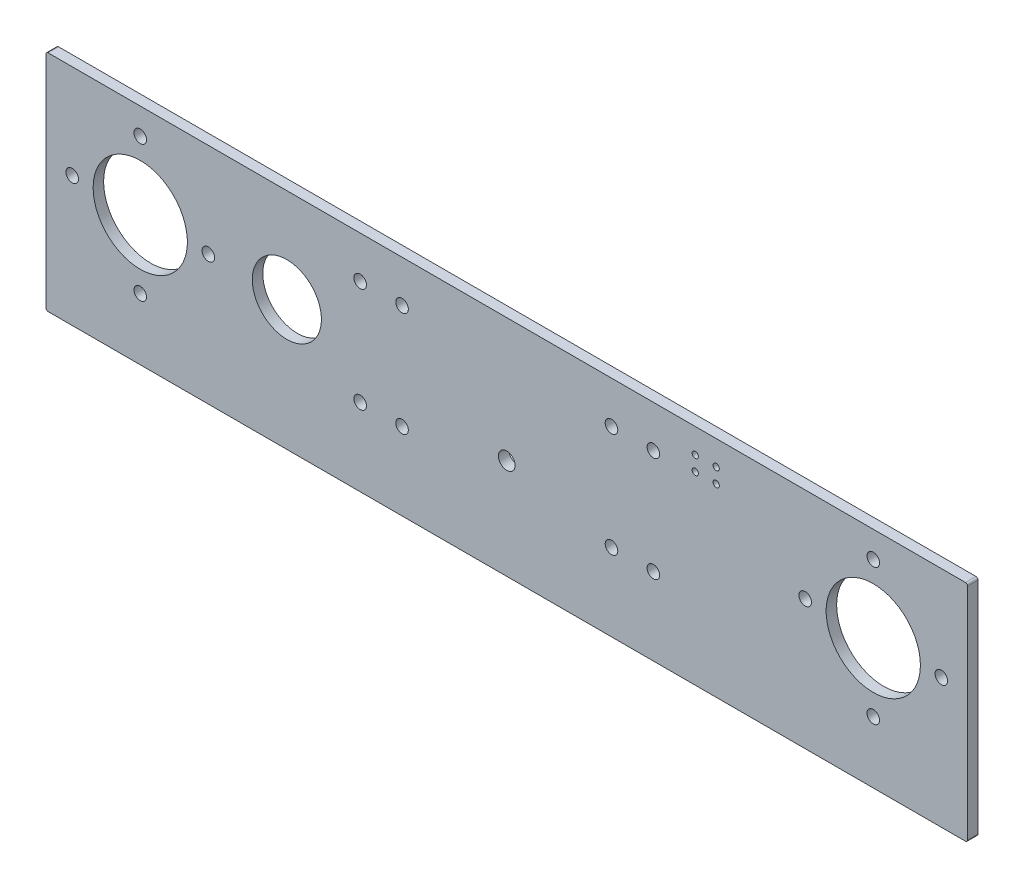
from build123d import *

# Parameters (mm, degrees)
SKETCH_1_W               = 440
SKETCH_1_H               = 107
SM_BASE_FLANGE_1_DEPTH   = 5
SKETCH_8_R               = 22.5
CUT_EXTRUDE_1_DEPTH      = 10
SKETCH_9_R               = 3
CUT_EXTRUDE_2_DEPTH      = 10
SKETCH_10_R              = 16.5
CUT_EXTRUDE_3_DEPTH      = 10
SKETCH_11_R              = 4
CUT_EXTRUDE_4_DEPTH      = 10
SKETCH_12_R              = 3
CUT_EXTRUDE_5_DEPTH      = 10
MIRROR_3_COPY_1_SKETCH_R = 3
MIRROR_3_COPY_1_DEPTH    = 10
FILLET_1_R               = 1
SKETCH_13_R              = 1.5
CUT_EXTRUDE_6_DEPTH      = 10


# Sheet-metal steps are written as plain solids
with BuildPart() as part:
    # Sketch 1 → 基体-法兰1 (new body)
    with BuildSketch(Plane.XY):
        Rectangle(SKETCH_1_W, SKETCH_1_H)
    extrude(amount=-SM_BASE_FLANGE_1_DEPTH)

    # 草图8 → 切除-拉伸1 (cut)
    with BuildSketch(Plane.XY):
        with Locations((175, 8.5)):
            Circle(SKETCH_8_R)
    cut_extrude_1 = extrude(amount=-CUT_EXTRUDE_1_DEPTH, mode=Mode.SUBTRACT)

    # 草图9 → 切除-拉伸2 (cut)
    with BuildSketch(Plane.XY):
        with Locations((175, 41)):
            Circle(SKETCH_9_R)
        with Locations((207.5, 8.5)):
            Circle(SKETCH_9_R)
        with Locations((175, -24)):
            Circle(SKETCH_9_R)
        with Locations((142.5, 8.5)):
            Circle(SKETCH_9_R)
    cut_extrude_2 = extrude(amount=-CUT_EXTRUDE_2_DEPTH, mode=Mode.SUBTRACT)

    # 镜向1: 切除-拉伸1, 切除-拉伸2 across plane
    add(cut_extrude_1.mirror(Plane(origin=(0, 0, 0), x_dir=(0, 0, 1), z_dir=(1, 0, 0))), mode=Mode.SUBTRACT)
    add(cut_extrude_2.mirror(Plane(origin=(0, 0, 0), x_dir=(0, 0, 1), z_dir=(1, 0, 0))), mode=Mode.SUBTRACT)

    # 草图10 → 切除-拉伸3 (cut)
    with BuildSketch(Plane(origin=(0, 0, -5), x_dir=(-1, 0, 0), z_dir=(0, 0, -1))):
        with Locations((105, 8.5)):
            Circle(SKETCH_10_R)
    extrude(amount=-CUT_EXTRUDE_3_DEPTH, mode=Mode.SUBTRACT)

    # 草图11 → 切除-拉伸4 (cut)
    with BuildSketch(Plane(origin=(0, 0, -5), x_dir=(-1, 0, 0), z_dir=(0, 0, -1))):
        with Locations((0, -5.630506542)):
            Circle(SKETCH_11_R)
    extrude(amount=-CUT_EXTRUDE_4_DEPTH, mode=Mode.SUBTRACT)

    # 草图12 → 切除-拉伸5 (cut)
    with BuildSketch(Plane(origin=(0, 0, -5), x_dir=(-1, 0, 0), z_dir=(0, 0, -1))):
        with Locations((-70, 33.5)):
            Circle(SKETCH_12_R)
        with Locations((-50, 33.5)):
            Circle(SKETCH_12_R)
    cut_extrude_5 = extrude(amount=-CUT_EXTRUDE_5_DEPTH, mode=Mode.SUBTRACT)

    # 镜向2: 切除-拉伸5 across plane
    add(cut_extrude_5.mirror(Plane(origin=(0, 0, 0), x_dir=(0, 0, 1), z_dir=(1, 0, 0))), mode=Mode.SUBTRACT)

    # 镜向3: 切除-拉伸5 across plane
    add(cut_extrude_5.mirror(Plane.ZX.offset(8.5)), mode=Mode.SUBTRACT)

    # 镜向3 copy 1 sketch → 镜向3 copy 1 (cut)
    with BuildSketch(Plane(origin=(0, 17, -5), x_dir=(1, 0, 0), z_dir=(0, 0, -1))):
        with Locations((-70, 33.5)):
            Circle(MIRROR_3_COPY_1_SKETCH_R)
        with Locations((-50, 33.5)):
            Circle(MIRROR_3_COPY_1_SKETCH_R)
    extrude(amount=-MIRROR_3_COPY_1_DEPTH, mode=Mode.SUBTRACT)

    # 圆角1
    fillet_1_edges = [part.edges().sort_by_distance(p)[0] for p in [
        (220, -53.5, -2.5),
        (-220, -53.5, -2.5),
        (-220, 53.5, -2.5),
        (220, 53.5, -2.5),
    ]]
    fillet(fillet_1_edges, radius=FILLET_1_R)

    # 草图13 → 切除-拉伸6 (cut)
    with BuildSketch(Plane(origin=(0, 0, -5), x_dir=(-1, 0, 0), z_dir=(0, 0, -1))):
        with Locations((-100, 41.75)):
            Circle(SKETCH_13_R)
        with Locations((-90, 41.75)):
            Circle(SKETCH_13_R)
        with Locations((-90, 34.75)):
            Circle(SKETCH_13_R)
        with Locations((-100, 34.75)):
            Circle(SKETCH_13_R)
    extrude(amount=-CUT_EXTRUDE_6_DEPTH, mode=Mode.SUBTRACT)


solid = part.part
